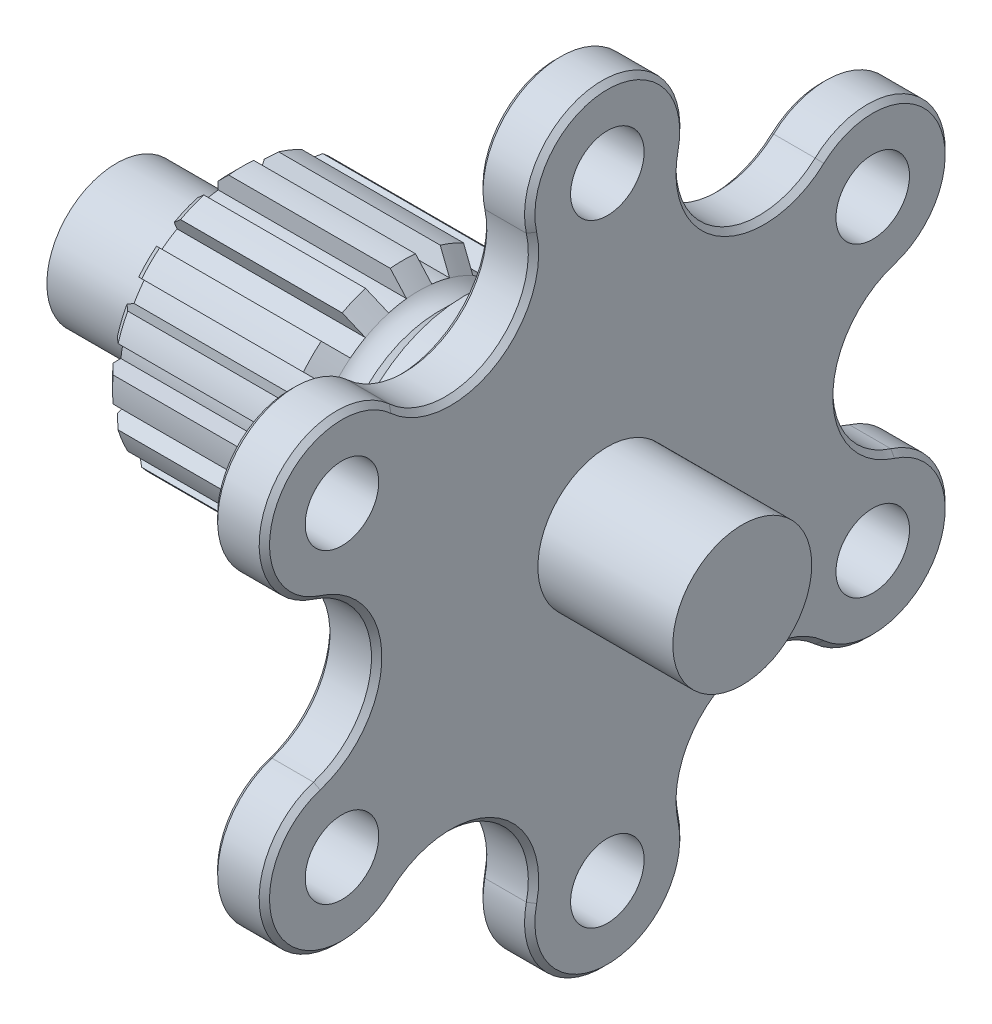
from build123d import *

# Parameters (mm, degrees)
SKETCH1_R              = 47
BASE_EXTRUDE_DEPTH     = 6.35
M8_CLEARANCE_HOLES_D   = 9
CIRPATTERN_COUNT       = 6
CUT_EXTRUDE_DEPTH      = 67.770670957
CUT_EXTRUDE_DEPTH_BACK = 67.770670957
CHAMFER1_SIZE          = 0.635
SKETCH8_R              = 15.748
SHAFT_EXTRUDE_DEPTH    = 52.5820005
CHAMFER3_SIZE          = 0.635
SHAFT_CHAMFER_SIZE     = 1
CUT_EXTRUDE1_START     = -12.856999432
SKETCH45_R             = 15.748
SKETCH45_R_2           = 8.5127
CUT_EXTRUDE1_DEPTH     = 12.856999432
SKETCH55_R             = 8.5
BOSS_EXTRUDE4_DEPTH    = 16.51
SKETCH56_R             = 8.5127
BOSS_EXTRUDE5_DEPTH    = 1.143
FILLET9_R              = 1.524
FILLET12_R             = 3.175
CUT_EXTRUDE20_START    = -25.4
CUT_EXTRUDE20_DEPTH    = 25.4
CHAMFER7_SIZE          = 1.27


with BuildPart() as part:
    # Sketch1 → Base-Extrude (new body)
    with BuildSketch(Plane(origin=(0, 0, 0), x_dir=(0, 0, -1), z_dir=(1, 0, 0))):
        Circle(SKETCH1_R)
    extrude(amount=-BASE_EXTRUDE_DEPTH)

    # M8 Clearance Holes (through all)
    with Locations(Plane(origin=(0, 0, 0), x_dir=(0, 0, -1), z_dir=(1, 0, 0))):
        with Locations((0, -37.5)):
            m8_clearance_holes = Hole(M8_CLEARANCE_HOLES_D / 2)

    # CirPattern: M8 Clearance Holes ×6 about axis
    cirpattern_axis = Axis((-6.35, 0, 0), (1, 0, 0))
    for i in range(1, CIRPATTERN_COUNT):
        add(m8_clearance_holes.rotate(cirpattern_axis, i * 360 / CIRPATTERN_COUNT), mode=Mode.SUBTRACT)

    # Sketch19 → Cut-Extrude (cut, two sides: drawn at the far end of the back side and taken through both)
    with BuildSketch(Plane(origin=(0, 0, 0), x_dir=(0, 0, -1), z_dir=(1, 0, 0)).offset(-CUT_EXTRUDE_DEPTH_BACK)):
        with BuildLine():
            ThreePointArc((9.274838239, 35.443941724), (14.114033661, 24.446223401), (26.057934823, 25.754216393))
            ThreePointArc((26.057934823, 25.754216393), (33.921184851, 28.139425108), (40.703194264, 23.499999504))
            ThreePointArc((40.703194264, 23.499999504), (23.500000227, 40.703193847), (-4.7e-08, 47))
            ThreePointArc((-4.7e-08, 47), (7.40886473, 43.446320157), (9.274838239, 35.443941724))
        make_face()
        with BuildLine():
            ThreePointArc((-26.057934823, 25.754216393), (-14.114033661, 24.446223401), (-9.274838239, 35.443941724))
            ThreePointArc((-9.274838239, 35.443941724), (-7.40886476, 43.44632012), (-4.7e-08, 47))
            ThreePointArc((-4.7e-08, 47), (-23.500000787, 40.703193523), (-40.703194863, 23.499998466))
            ThreePointArc((-40.703194863, 23.499998466), (-33.921185443, 28.139425017), (-26.057934823, 25.754216393))
        make_face()
        with BuildLine():
            ThreePointArc((40.703193464, -23.50000089), (47, -8e-07), (40.703194264, 23.499999504))
            ThreePointArc((40.703194264, 23.499999504), (41.33004921, 15.30689472), (35.332773062, 9.689725331))
            ThreePointArc((35.332773062, 9.689725331), (28.228067323, 0), (35.332773062, -9.689725331))
            ThreePointArc((35.332773062, -9.689725331), (41.330049499, -15.306895465), (40.703193464, -23.50000089))
        make_face()
        with BuildLine():
            ThreePointArc((-35.332773062, 9.689725331), (-41.330048992, 15.306894161), (-40.703194863, 23.499998466))
            ThreePointArc((-40.703194863, 23.499998466), (-47, -6.9e-08), (-40.703194794, -23.499998586))
            ThreePointArc((-40.703194794, -23.499998586), (-41.330049018, -15.306894226), (-35.332773062, -9.689725331))
            ThreePointArc((-35.332773062, -9.689725331), (-28.228067323, 0), (-35.332773062, 9.689725331))
        make_face()
        with BuildLine():
            ThreePointArc((-26.057934823, -25.754216393), (-33.921185375, -28.139425028), (-40.703194794, -23.499998586))
            ThreePointArc((-40.703194794, -23.499998586), (-23.500000688, -40.703193581), (4.4e-08, -47))
            ThreePointArc((4.4e-08, -47), (-7.408864732, -43.446320155), (-9.274838239, -35.443941724))
            ThreePointArc((-9.274838239, -35.443941724), (-14.114033661, -24.446223401), (-26.057934823, -25.754216393))
        make_face()
        with BuildLine():
            ThreePointArc((4.4e-08, -47), (23.499999574, -40.703194224), (40.703193464, -23.50000089))
            ThreePointArc((40.703193464, -23.50000089), (33.92118406, -28.13942523), (26.057934823, -25.754216393))
            ThreePointArc((26.057934823, -25.754216393), (14.114033661, -24.446223401), (9.274838239, -35.443941724))
            ThreePointArc((9.274838239, -35.443941724), (7.408864759, -43.446320121), (4.4e-08, -47))
        make_face()
    extrude(amount=CUT_EXTRUDE_DEPTH + CUT_EXTRUDE_DEPTH_BACK, mode=Mode.SUBTRACT)

    # Chamfer1
    chamfer1_edges = [part.edges().sort_by_distance(p)[0] for p in [
        (-6.35, 0, 28.228067323),
        (-6.35, -23.5, 40.703193978),
        (-6.35, 23.5, 40.703193978),
        (-6.35, -24.446223401, 14.114033661),
        (-6.35, 24.446223401, 14.114033661),
        (-6.35, -47, 0),
        (-6.35, 47, 0),
        (-6.35, -24.446223401, -14.114033661),
        (-6.35, -23.5, -40.703193978),
        (-6.35, 0, -28.228067323),
        (-6.35, 23.5, -40.703193978),
        (-6.35, 24.446223401, -14.114033661),
    ]]
    chamfer(chamfer1_edges, length=CHAMFER1_SIZE)

    # Sketch8 → Shaft-Extrude (add)
    with BuildSketch(Plane.ZY.offset(6.35)):
        Circle(SKETCH8_R)
    extrude(amount=SHAFT_EXTRUDE_DEPTH)

    # Chamfer3
    chamfer3_edges = [part.edges().sort_by_distance(p)[0] for p in [
        (0, -23.5, 40.703193978),
        (0, 0, 28.228067323),
        (0, -24.446223401, 14.114033661),
        (0, 23.5, 40.703193978),
        (0, -47, 0),
        (0, 24.446223401, 14.114033661),
        (0, -24.446223401, -14.114033661),
        (0, 47, 0),
        (0, 24.446223401, -14.114033661),
        (0, -23.5, -40.703193978),
        (0, 0, -28.228067323),
        (0, 23.5, -40.703193978),
    ]]
    chamfer(chamfer3_edges, length=CHAMFER3_SIZE)

    # Shaft Chamfer
    shaft_chamfer_edges = [part.edges().sort_by_distance(p)[0] for p in [
        (-58.9320005, 0, -15.748),
    ]]
    chamfer(shaft_chamfer_edges, length=SHAFT_CHAMFER_SIZE)

    # Sketch45 → Cut-Extrude1 (cut)
    with BuildSketch(Plane.ZY.offset(58.9320005).offset(CUT_EXTRUDE1_START)):
        Circle(SKETCH45_R)
        Circle(SKETCH45_R_2, mode=Mode.SUBTRACT)
    extrude(amount=CUT_EXTRUDE1_DEPTH, mode=Mode.SUBTRACT)

    # Sketch55 → Boss-Extrude4 (add)
    with BuildSketch(Plane(origin=(0, 0, 0), x_dir=(0, 0, -1), z_dir=(1, 0, 0))):
        Circle(SKETCH55_R)
    extrude(amount=BOSS_EXTRUDE4_DEPTH)

    # Sketch56 → Boss-Extrude5 (add)
    with BuildSketch(Plane.ZY.offset(58.9320005)):
        Circle(SKETCH56_R)
    extrude(amount=BOSS_EXTRUDE5_DEPTH)

    # Fillet9
    fillet9_edges = [part.edges().sort_by_distance(p)[0] for p in [
        (-46.075001068, 0, -8.5127),
    ]]
    fillet(fillet9_edges, radius=FILLET9_R)

    # Fillet12
    fillet12_edges = [part.edges().sort_by_distance(p)[0] for p in [
        (-6.35, 0, -15.748),
    ]]
    fillet(fillet12_edges, radius=FILLET12_R)

    # Sketch102 → Cut-Extrude20 (cut)
    with BuildSketch(Plane.ZY.offset(46.075001068).offset(CUT_EXTRUDE20_START)):
        with BuildLine():
            Line((-1.543304, 13.455060235), (-1.543304, 15.672195659))
            ThreePointArc((-1.543304, 15.672195659), (-3.072282391, 15.445406596), (-4.571662649, 15.06981767))
            Line((-4.571662649, 15.06981767), (-3.723201655, 13.021451632))
            ThreePointArc((-3.723201655, 13.021451632), (-2.642162856, 13.283049672), (-1.543304, 13.455060235))
        make_face()
        with BuildLine():
            ThreePointArc((4.571662649, 15.06981767), (3.072282391, 15.445406596), (1.543304, 15.672195659))
            Line((1.543304, 15.672195659), (1.543304, 13.455060235))
            ThreePointArc((1.543304, 13.455060235), (2.642162856, 13.283049672), (3.723201655, 13.021451632))
            Line((3.723201655, 13.021451632), (4.571662649, 15.06981767))
        make_face()
        with BuildLine():
            Line((-6.574855611, 11.840257888), (-7.423316605, 13.888623927))
            ThreePointArc((-7.423316605, 13.888623927), (-8.74912003, 13.093983455), (-9.990635102, 12.17319655))
            Line((-9.990635102, 12.17319655), (-8.422883609, 10.605445057))
            ThreePointArc((-8.422883609, 10.605445057), (-7.524243225, 11.260825771), (-6.574855611, 11.840257888))
        make_face()
        with BuildLine():
            ThreePointArc((9.990635102, 12.17319655), (8.74912003, 13.093983455), (7.423316605, 13.888623927))
            Line((7.423316605, 13.888623927), (6.574855611, 11.840257888))
            ThreePointArc((6.574855611, 11.840257888), (7.524243225, 11.260825771), (8.422883609, 10.605445057))
            Line((8.422883609, 10.605445057), (9.990635102, 12.17319655))
        make_face()
        with BuildLine():
            Line((-10.605445057, 8.422883609), (-12.17319655, 9.990635102))
            ThreePointArc((-12.17319655, 9.990635102), (-13.093983455, 8.74912003), (-13.888623927, 7.423316605))
            Line((-13.888623927, 7.423316605), (-11.840257888, 6.574855611))
            ThreePointArc((-11.840257888, 6.574855611), (-11.260825771, 7.524243225), (-10.605445057, 8.422883609))
        make_face()
        with BuildLine():
            ThreePointArc((13.888623927, 7.423316605), (13.093983455, 8.74912003), (12.17319655, 9.990635102))
            Line((12.17319655, 9.990635102), (10.605445057, 8.422883609))
            ThreePointArc((10.605445057, 8.422883609), (11.260825771, 7.524243225), (11.840257888, 6.574855611))
            Line((11.840257888, 6.574855611), (13.888623927, 7.423316605))
        make_face()
        with BuildLine():
            Line((-13.021451632, 3.723201655), (-15.06981767, 4.571662649))
            ThreePointArc((-15.06981767, 4.571662649), (-15.445406596, 3.072282391), (-15.672195659, 1.543304))
            Line((-15.672195659, 1.543304), (-13.455060235, 1.543304))
            ThreePointArc((-13.455060235, 1.543304), (-13.283049672, 2.642162856), (-13.021451632, 3.723201655))
        make_face()
        with BuildLine():
            ThreePointArc((15.672195659, 1.543304), (15.445406596, 3.072282391), (15.06981767, 4.571662649))
            Line((15.06981767, 4.571662649), (13.021451632, 3.723201655))
            ThreePointArc((13.021451632, 3.723201655), (13.283049672, 2.642162856), (13.455060235, 1.543304))
            Line((13.455060235, 1.543304), (15.672195659, 1.543304))
        make_face()
        with BuildLine():
            Line((-13.455060235, -1.543304), (-15.672195659, -1.543304))
            ThreePointArc((-15.672195659, -1.543304), (-15.445406596, -3.072282391), (-15.06981767, -4.571662649))
            Line((-15.06981767, -4.571662649), (-13.021451632, -3.723201655))
            ThreePointArc((-13.021451632, -3.723201655), (-13.283049672, -2.642162856), (-13.455060235, -1.543304))
        make_face()
        with BuildLine():
            ThreePointArc((15.06981767, -4.571662649), (15.445406596, -3.072282391), (15.672195659, -1.543304))
            Line((15.672195659, -1.543304), (13.455060235, -1.543304))
            ThreePointArc((13.455060235, -1.543304), (13.283049672, -2.642162856), (13.021451632, -3.723201655))
            Line((13.021451632, -3.723201655), (15.06981767, -4.571662649))
        make_face()
        with BuildLine():
            Line((-11.840257888, -6.574855611), (-13.888623927, -7.423316605))
            ThreePointArc((-13.888623927, -7.423316605), (-13.093983455, -8.74912003), (-12.17319655, -9.990635102))
            Line((-12.17319655, -9.990635102), (-10.605445057, -8.422883609))
            ThreePointArc((-10.605445057, -8.422883609), (-11.260825771, -7.524243225), (-11.840257888, -6.574855611))
        make_face()
        with BuildLine():
            ThreePointArc((12.17319655, -9.990635102), (13.093983455, -8.74912003), (13.888623927, -7.423316605))
            Line((13.888623927, -7.423316605), (11.840257888, -6.574855611))
            ThreePointArc((11.840257888, -6.574855611), (11.260825771, -7.524243225), (10.605445057, -8.422883609))
            Line((10.605445057, -8.422883609), (12.17319655, -9.990635102))
        make_face()
        with BuildLine():
            Line((-8.422883609, -10.605445057), (-9.990635102, -12.17319655))
            ThreePointArc((-9.990635102, -12.17319655), (-8.74912003, -13.093983455), (-7.423316605, -13.888623927))
            Line((-7.423316605, -13.888623927), (-6.574855611, -11.840257888))
            ThreePointArc((-6.574855611, -11.840257888), (-7.524243225, -11.260825771), (-8.422883609, -10.605445057))
        make_face()
        with BuildLine():
            ThreePointArc((7.423316605, -13.888623927), (8.74912003, -13.093983455), (9.990635102, -12.17319655))
            Line((9.990635102, -12.17319655), (8.422883609, -10.605445057))
            ThreePointArc((8.422883609, -10.605445057), (7.524243225, -11.260825771), (6.574855611, -11.840257888))
            Line((6.574855611, -11.840257888), (7.423316605, -13.888623927))
        make_face()
        with BuildLine():
            Line((-3.723201655, -13.021451632), (-4.571662649, -15.06981767))
            ThreePointArc((-4.571662649, -15.06981767), (-3.072282391, -15.445406596), (-1.543304, -15.672195659))
            Line((-1.543304, -15.672195659), (-1.543304, -13.455060235))
            ThreePointArc((-1.543304, -13.455060235), (-2.642162856, -13.283049672), (-3.723201655, -13.021451632))
        make_face()
        with BuildLine():
            ThreePointArc((1.543304, -15.672195659), (3.072282391, -15.445406596), (4.571662649, -15.06981767))
            Line((4.571662649, -15.06981767), (3.723201655, -13.021451632))
            ThreePointArc((3.723201655, -13.021451632), (2.642162856, -13.283049672), (1.543304, -13.455060235))
            Line((1.543304, -13.455060235), (1.543304, -15.672195659))
        make_face()
    extrude(amount=CUT_EXTRUDE20_DEPTH, mode=Mode.SUBTRACT)

    # Sketch104 → Cut-Revolve3 (revolve, cut)
    with BuildSketch(Plane.XY):
        with BuildLine():
            Line((-20.675001068, 12.497195659), (-17.500001068, 15.672195659))
            Line((-17.500001068, 15.672195659), (-17.500001068, 16.432455683))
            Line((-17.500001068, 16.432455683), (-23.850001068, 16.432455683))
            Line((-23.850001068, 16.432455683), (-25.56386945, 16.3462787))
            Line((-25.56386945, 16.3462787), (-23.030493186, 13.54328))
            ThreePointArc((-23.030493186, 13.54328), (-21.963666615, 12.770477873), (-20.675001068, 12.497195659))
        make_face()
    revolve(axis=Axis((-47.599001068, 0, 0), (-1, 0, 0)), mode=Mode.SUBTRACT)

    # Chamfer7
    chamfer7_edges = [part.edges().sort_by_distance(p)[0] for p in [
        (-46.075001068, -15.748, 0),
        (-46.075001068, -14.549254878, -6.026498693),
        (-46.075001068, -11.13551759, -11.13551759),
        (-46.075001068, -6.026498693, -14.549254878),
        (-46.075001068, 0, -15.748),
        (-46.075001068, 6.026498693, -14.549254878),
        (-46.075001068, 11.13551759, -11.13551759),
        (-46.075001068, 14.549254878, -6.026498693),
        (-46.075001068, 15.748, 0),
        (-46.075001068, -14.549254878, 6.026498693),
        (-46.075001068, -11.13551759, 11.13551759),
        (-46.075001068, -6.026498693, 14.549254878),
        (-46.075001068, 0, 15.748),
        (-46.075001068, 6.026498693, 14.549254878),
        (-46.075001068, 11.13551759, 11.13551759),
        (-46.075001068, 14.549254878, 6.026498693),
    ]]
    chamfer(chamfer7_edges, length=CHAMFER7_SIZE)


solid = part.part
